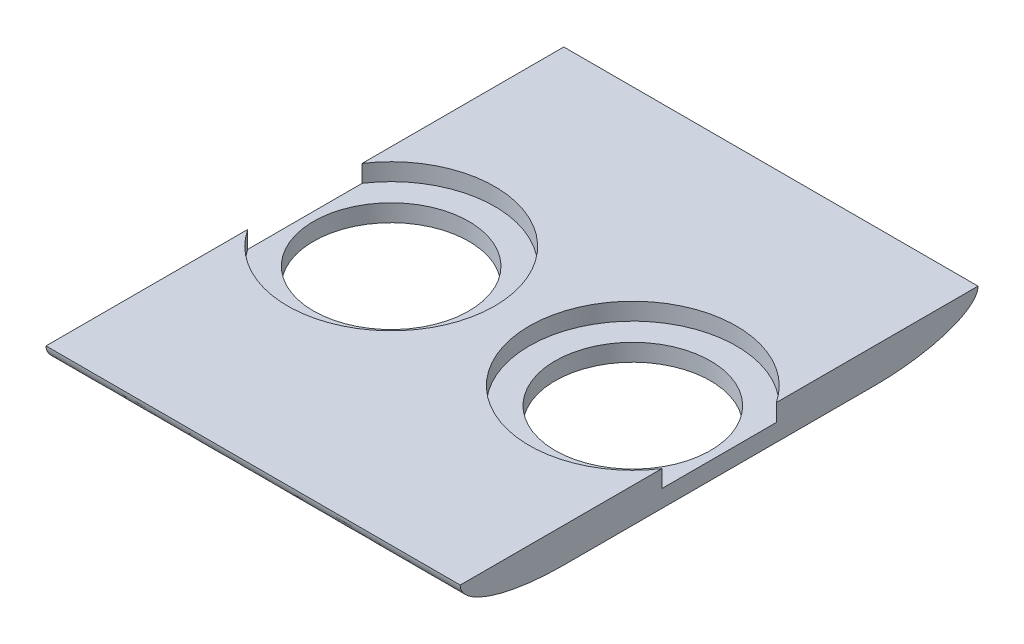
from build123d import *

# Parameters (mm, degrees)
SKETCH2_W           = 120
SKETCH2_H           = 150
BOSS_EXTRUDE1_DEPTH = 10
SKETCH3_R           = 30
CUT_EXTRUDE1_DEPTH  = 5
SKETCH4_R           = 22.5
CUT_EXTRUDE2_DEPTH  = 5
FILLET1_SIZE        = 30
FILLET1_SIZE_2      = 10


with BuildPart() as part:
    # Sketch2 → Boss-Extrude1 (new body)
    with BuildSketch(Plane(origin=(0, 0, 0), x_dir=(1, 0, 0), z_dir=(0, 1, 0))):
        Rectangle(SKETCH2_W, SKETCH2_H)
    extrude(amount=BOSS_EXTRUDE1_DEPTH)

    # Sketch3 → Cut-Extrude1 (cut)
    with BuildSketch(Plane(origin=(0, 10, 0), x_dir=(1, 0, 0), z_dir=(0, 1, 0))):
        with Locations((35, 0)):
            Circle(SKETCH3_R)
        with Locations((-35, 0)):
            Circle(SKETCH3_R)
    extrude(amount=-CUT_EXTRUDE1_DEPTH, mode=Mode.SUBTRACT)

    # Sketch4 → Cut-Extrude2 (cut)
    with BuildSketch(Plane(origin=(0, 5, 0), x_dir=(1, 0, 0), z_dir=(0, 1, 0))):
        with Locations(Location((-35, 0, 0), (0, 0, 270))):
            Circle(SKETCH4_R)
        with Locations(Location((35, 0, 0), (0, 0, 270))):
            Circle(SKETCH4_R)
    extrude(amount=-CUT_EXTRUDE2_DEPTH, mode=Mode.SUBTRACT)

    # Fillet1
    # an asymmetric fillet: 30, 10 mm, written as the material it takes off along each edge
    with BuildSketch(Plane(origin=(135, 0, -75), x_dir=(0, 0, 1), z_dir=(-1, 0, 0))) as fillet1_piece_1:
        with BuildLine():
            Bezier((FILLET1_SIZE, 0), (0, 0), (0, FILLET1_SIZE_2), weights=[1, 0.707106781, 1])
            Line((0, FILLET1_SIZE_2), (0, 0))
            Line((0, 0), (FILLET1_SIZE, 0))
        make_face()
    extrude(amount=270, mode=Mode.SUBTRACT)
    with BuildSketch(Plane(origin=(-135, 0, 75), x_dir=(0, 1, 0), z_dir=(1, 0, 0))) as fillet1_piece_2:
        with BuildLine():
            Bezier((FILLET1_SIZE_2, 0), (0, 0), (0, -FILLET1_SIZE), weights=[1, 0.707106781, 1])
            Line((0, -FILLET1_SIZE), (0, 0))
            Line((0, 0), (FILLET1_SIZE_2, 0))
        make_face()
    extrude(amount=270, mode=Mode.SUBTRACT)


solid = part.part
